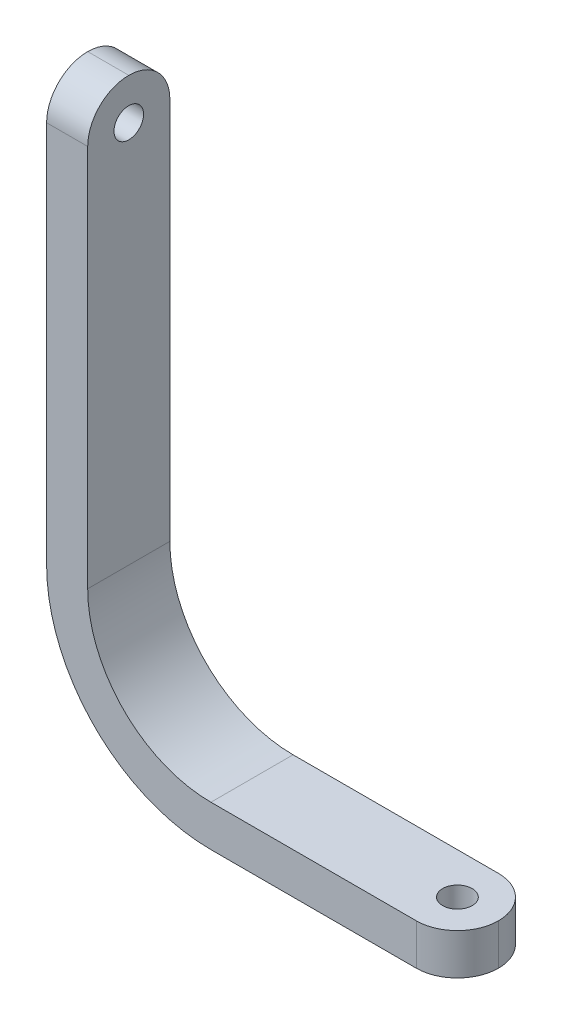
from build123d import *

# Parameters (mm, degrees)
BOSS_EXTRUDE1_DEPTH  = 10
FILLET1_R            = 5
M3_CLEARANCE_HOLE1_D = 3.6
M3_CLEARANCE_HOLE2_D = 3.6


with BuildPart() as part:
    # Sketch3 → Boss-Extrude1 (new body)
    with BuildSketch(Plane.XY):
        with BuildLine():
            Line((0, 0), (-30, 0))
            ThreePointArc((-30, 0), (-44.142135624, 5.857864376), (-50, 20))
            Line((-50, 20), (-50, 71.627417))
            Line((-50, 71.627417), (-45, 71.627417))
            Line((-45, 71.627417), (-45, 20))
            ThreePointArc((-45, 20), (-40.606601718, 9.393398282), (-30, 5))
            Line((-30, 5), (0, 5))
            Line((0, 5), (0, 0))
        make_face()
    extrude(amount=BOSS_EXTRUDE1_DEPTH)

    # Fillet1
    fillet1_edges = [part.edges().sort_by_distance(p)[0] for p in [
        (0, 2.5, 10),
        (0, 2.5, 0),
        (-47.5, 71.627417, 0),
        (-47.5, 71.627417, 10),
    ]]
    fillet(fillet1_edges, radius=FILLET1_R - 0.0001)  # a hair under: the kernel refuses the full size

    # M3 Clearance Hole1 (through all)
    with Locations(Plane.XZ):
        with Locations((-5, 5)):
            Hole(M3_CLEARANCE_HOLE1_D / 2)

    # M3 Clearance Hole2 (through all)
    with Locations(Plane.ZY.offset(50)):
        with Locations((5, 66.627417)):
            Hole(M3_CLEARANCE_HOLE2_D / 2)


solid = part.part
